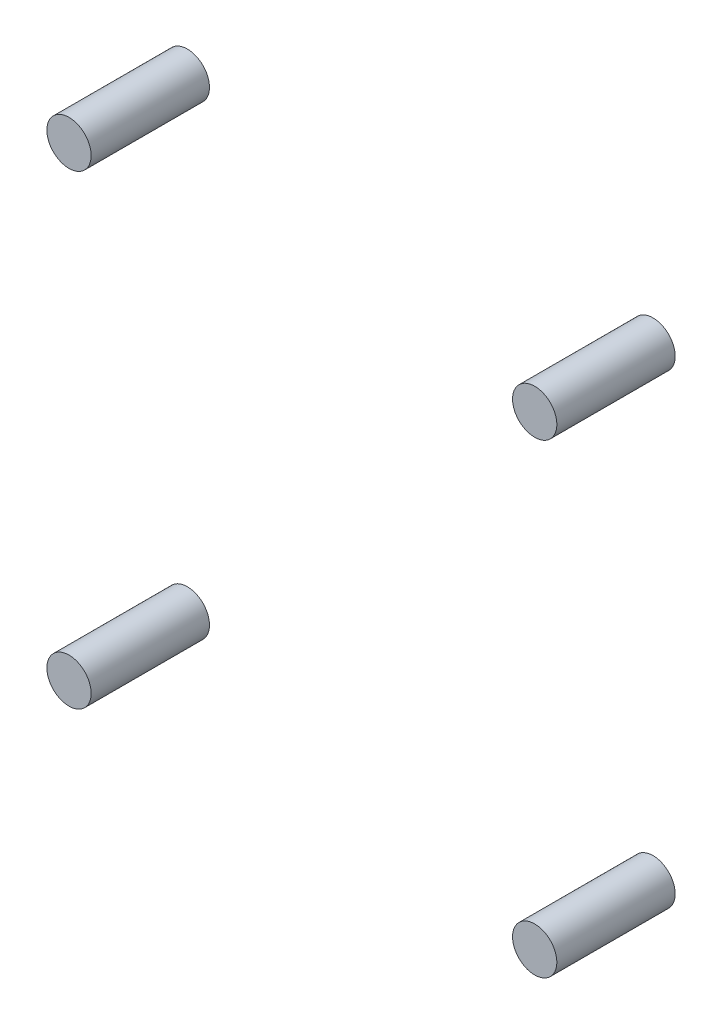
from build123d import *

# Parameters (mm, degrees)
SKETCH1_R             = 3.104394748
BOSS_EXTRUDE1_DEPTH   = 16.6
BOSS_EXTRUDE1_2_DEPTH = 16.6
BOSS_EXTRUDE1_3_DEPTH = 16.6
BOSS_EXTRUDE1_4_DEPTH = 16.6


with BuildPart() as part:
    # Sketch1 → Boss-Extrude1 (new body)
    with BuildSketch(Plane.XY):
        with Locations((32.657870065, -32.657870065)):
            Circle(SKETCH1_R)
    extrude(amount=BOSS_EXTRUDE1_DEPTH)


with BuildPart() as body_2:
    # Sketch1 → Boss-Extrude1 2 (new body)
    with BuildSketch(Plane.XY):
        with Locations((-32.657870065, 32.657870065)):
            Circle(SKETCH1_R)
    extrude(amount=BOSS_EXTRUDE1_2_DEPTH)


with BuildPart() as body_3:
    # Sketch1 → Boss-Extrude1 3 (new body)
    with BuildSketch(Plane.XY):
        with Locations((-32.657870065, -32.657870065)):
            Circle(SKETCH1_R)
    extrude(amount=BOSS_EXTRUDE1_3_DEPTH)


with BuildPart() as body_4:
    # Sketch1 → Boss-Extrude1 4 (new body)
    with BuildSketch(Plane.XY):
        with Locations((32.657870065, 32.657870065)):
            Circle(SKETCH1_R)
    extrude(amount=BOSS_EXTRUDE1_4_DEPTH)


solid = Compound([part.part, body_2.part, body_3.part, body_4.part])
